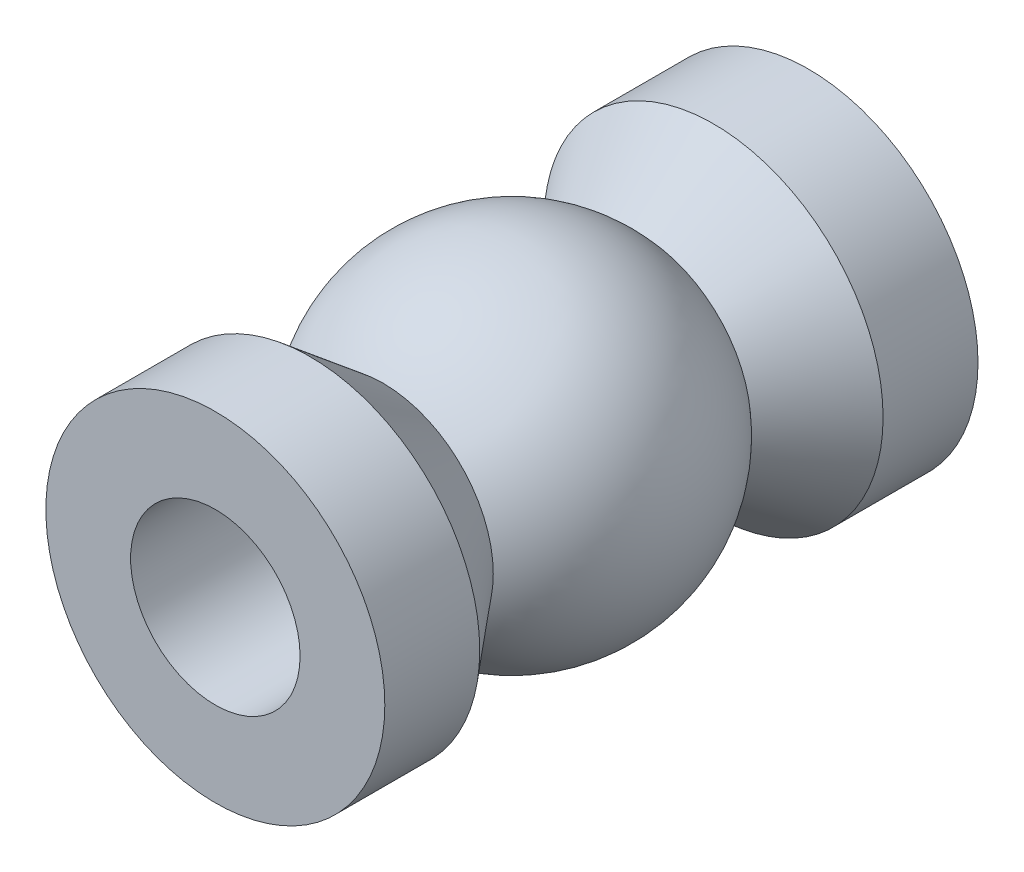
from build123d import *


with BuildPart() as part:
    # Sketch1 → Revolve1 (revolve)
    with BuildSketch(Plane(origin=(0, 0, 0), x_dir=(0, 0, -1), z_dir=(1, 0, 0))):
        with BuildLine():
            Line((-11.1125, -3.175), (11.1125, -3.175))
            Line((11.1125, -3.175), (11.1125, -6.35))
            Line((11.1125, -6.35), (7.5565, -6.35))
            Line((7.5565, -6.35), (4.826, -4.12701151))
            ThreePointArc((4.826, -4.12701151), (0, -6.35), (-4.826, -4.12701151))
            Line((-4.826, -4.12701151), (-7.5565, -6.35))
            Line((-7.5565, -6.35), (-11.1125, -6.35))
            Line((-11.1125, -6.35), (-11.1125, -3.175))
        make_face()
    revolve(axis=Axis((0, 0, -0.069344774), (0, 0, -1)))


solid = part.part
